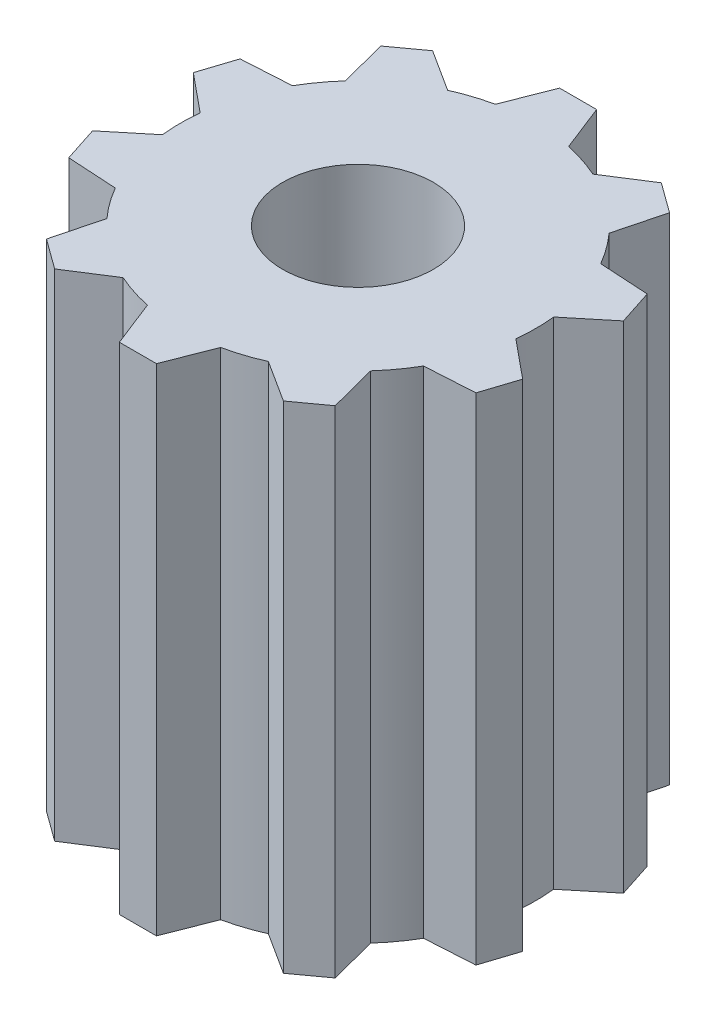
from build123d import *

# Parameters (mm, degrees)
SKETCH1_R            = 3.5
BOSS_EXTRUDE1_DEPTH  = 5
SKETCH12_R           = 8.25
SKETCH12_R_2         = 3.5
BOSS_EXTRUDE6_DEPTH  = 5
BOSS_EXTRUDE9_DEPTH  = 5
CIRPATTERN2_COUNT    = 10
CUT_EXTRUDE1_START   = -10
SKETCH14_R           = 3.5
CUT_EXTRUDE1_DEPTH   = 10
SKETCH17_R           = 3.5
BOSS_EXTRUDE10_DEPTH = 18


with BuildPart() as part:
    # Sketch1 → Boss-Extrude1 (new body)
    with BuildSketch(Plane(origin=(0, 0, 0), x_dir=(1, 0, 0), z_dir=(0, 1, 0))):
        Circle(SKETCH1_R)
    extrude(amount=BOSS_EXTRUDE1_DEPTH)

    # Sketch14 → Cut-Extrude1 (cut)
    with BuildSketch(Plane(origin=(0, 5, 0), x_dir=(1, 0, 0), z_dir=(0, 1, 0)).offset(CUT_EXTRUDE1_START)):
        Circle(SKETCH14_R)
    extrude(amount=CUT_EXTRUDE1_DEPTH, mode=Mode.SUBTRACT)


with BuildPart() as body_2:
    # Sketch12 → Boss-Extrude6 (new body)
    with BuildSketch(Plane(origin=(0, 5, 0), x_dir=(-1, 0, 0), z_dir=(0, -1, 0))):
        Circle(SKETCH12_R)
        Circle(SKETCH12_R_2, mode=Mode.SUBTRACT)
    extrude(amount=BOSS_EXTRUDE6_DEPTH)



with BuildPart() as body_3:
    # Sketch13 → Boss-Extrude9 (new body)
    with BuildSketch(Plane.XZ):
        with BuildLine():
            Line((1.7, 8.072948656), (0.86, 10.213858233))
            Line((0.86, 10.213858233), (-0.86, 10.213858233))
            Line((-0.86, 10.213858233), (-1.7, 8.072948656))
            ThreePointArc((-1.7, 8.072948656), (0, 8.25), (1.7, 8.072948656))
        make_face()
    extrude(amount=-BOSS_EXTRUDE9_DEPTH)


with BuildPart() as cirpattern2_1:
    # CirPattern2: pattern copy
    add(body_3.part.rotate(Axis((0, 0, 0), (0, -1, 0)), 1 * 360 / CIRPATTERN2_COUNT))


with BuildPart() as cirpattern2_2:
    # CirPattern2: pattern copy
    add(body_3.part.rotate(Axis((0, 0, 0), (0, -1, 0)), 2 * 360 / CIRPATTERN2_COUNT))


with BuildPart() as cirpattern2_3:
    # CirPattern2: pattern copy
    add(body_3.part.rotate(Axis((0, 0, 0), (0, -1, 0)), 3 * 360 / CIRPATTERN2_COUNT))


with BuildPart() as cirpattern2_4:
    # CirPattern2: pattern copy
    add(body_3.part.rotate(Axis((0, 0, 0), (0, -1, 0)), 4 * 360 / CIRPATTERN2_COUNT))


with BuildPart() as cirpattern2_5:
    # CirPattern2: pattern copy
    add(body_3.part.rotate(Axis((0, 0, 0), (0, -1, 0)), 5 * 360 / CIRPATTERN2_COUNT))


with BuildPart() as cirpattern2_6:
    # CirPattern2: pattern copy
    add(body_3.part.rotate(Axis((0, 0, 0), (0, -1, 0)), 6 * 360 / CIRPATTERN2_COUNT))


with BuildPart() as cirpattern2_7:
    # CirPattern2: pattern copy
    add(body_3.part.rotate(Axis((0, 0, 0), (0, -1, 0)), 7 * 360 / CIRPATTERN2_COUNT))


with BuildPart() as cirpattern2_8:
    # CirPattern2: pattern copy
    add(body_3.part.rotate(Axis((0, 0, 0), (0, -1, 0)), 8 * 360 / CIRPATTERN2_COUNT))


with BuildPart() as cirpattern2_9:
    # CirPattern2: pattern copy
    add(body_3.part.rotate(Axis((0, 0, 0), (0, -1, 0)), 9 * 360 / CIRPATTERN2_COUNT))


with BuildPart() as body_2_1:
    add(body_2.part)

    add(body_3.part)  # Boss-Extrude10 merges body 3

    add(cirpattern2_1.part)  # Boss-Extrude10 merges CirPattern2_1

    add(cirpattern2_2.part)  # Boss-Extrude10 merges CirPattern2_2

    add(cirpattern2_3.part)  # Boss-Extrude10 merges CirPattern2_3

    add(cirpattern2_4.part)  # Boss-Extrude10 merges CirPattern2_4

    add(cirpattern2_5.part)  # Boss-Extrude10 merges CirPattern2_5

    add(cirpattern2_6.part)  # Boss-Extrude10 merges CirPattern2_6

    add(cirpattern2_7.part)  # Boss-Extrude10 merges CirPattern2_7

    add(cirpattern2_8.part)  # Boss-Extrude10 merges CirPattern2_8

    add(cirpattern2_9.part)  # Boss-Extrude10 merges CirPattern2_9
    # Sketch17 → Boss-Extrude10 (add)
    with BuildSketch(Plane.XZ):
        with BuildLine():
            Line((7.152501534, -4.111474407), (9.448201814, -3.974164376))
            Line((9.448201814, -3.974164376), (9.979711044, -2.338347168))
            Line((9.979711044, -2.338347168), (8.203159315, -0.877882252))
            ThreePointArc((8.203159315, -0.877882252), (8.25, 0), (8.203159315, 0.877882252))
            Line((8.203159315, 0.877882252), (9.979711044, 2.338347168))
            Line((9.979711044, 2.338347168), (9.448201814, 3.974164376))
            Line((9.448201814, 3.974164376), (7.152501534, 4.111474407))
            ThreePointArc((7.152501534, 4.111474407), (6.674390204, 4.849228331), (6.120489053, 5.531917728))
            Line((6.120489053, 5.531917728), (6.699309853, 7.757689572))
            Line((6.699309853, 7.757689572), (5.307800623, 8.768680205))
            Line((5.307800623, 8.768680205), (3.369831272, 7.530387586))
            ThreePointArc((3.369831272, 7.530387586), (2.549390204, 7.846216259), (1.7, 8.072948656))
            Line((1.7, 8.072948656), (0.86, 10.213858233))
            Line((0.86, 10.213858233), (-0.86, 10.213858233))
            Line((-0.86, 10.213858233), (-1.7, 8.072948656))
            ThreePointArc((-1.7, 8.072948656), (-2.549390204, 7.846216259), (-3.369831272, 7.530387586))
            Line((-3.369831272, 7.530387586), (-5.307800623, 8.768680205))
            Line((-5.307800623, 8.768680205), (-6.699309853, 7.757689572))
            Line((-6.699309853, 7.757689572), (-6.120489053, 5.531917728))
            ThreePointArc((-6.120489053, 5.531917728), (-6.674390204, 4.849228331), (-7.152501534, 4.111474407))
            Line((-7.152501534, 4.111474407), (-9.448201814, 3.974164376))
            Line((-9.448201814, 3.974164376), (-9.979711044, 2.338347168))
            Line((-9.979711044, 2.338347168), (-8.203159315, 0.877882252))
            ThreePointArc((-8.203159315, 0.877882252), (-8.25, 0), (-8.203159315, -0.877882252))
            Line((-8.203159315, -0.877882252), (-9.979711044, -2.338347168))
            Line((-9.979711044, -2.338347168), (-9.448201814, -3.974164376))
            Line((-9.448201814, -3.974164376), (-7.152501534, -4.111474407))
            ThreePointArc((-7.152501534, -4.111474407), (-6.674390204, -4.849228331), (-6.120489053, -5.531917728))
            Line((-6.120489053, -5.531917728), (-6.699309853, -7.757689572))
            Line((-6.699309853, -7.757689572), (-5.307800623, -8.768680205))
            Line((-5.307800623, -8.768680205), (-3.369831272, -7.530387586))
            ThreePointArc((-3.369831272, -7.530387586), (-2.549390204, -7.846216259), (-1.7, -8.072948656))
            Line((-1.7, -8.072948656), (-0.86, -10.213858233))
            Line((-0.86, -10.213858233), (0.86, -10.213858233))
            Line((0.86, -10.213858233), (1.7, -8.072948656))
            ThreePointArc((1.7, -8.072948656), (2.549390204, -7.846216259), (3.369831272, -7.530387586))
            Line((3.369831272, -7.530387586), (5.307800623, -8.768680205))
            Line((5.307800623, -8.768680205), (6.699309853, -7.757689572))
            Line((6.699309853, -7.757689572), (6.120489053, -5.531917728))
            ThreePointArc((6.120489053, -5.531917728), (6.674390204, -4.849228331), (7.152501534, -4.111474407))
        make_face()
        Circle(SKETCH17_R, mode=Mode.SUBTRACT)
    extrude(amount=BOSS_EXTRUDE10_DEPTH)


solid = body_2_1.part
